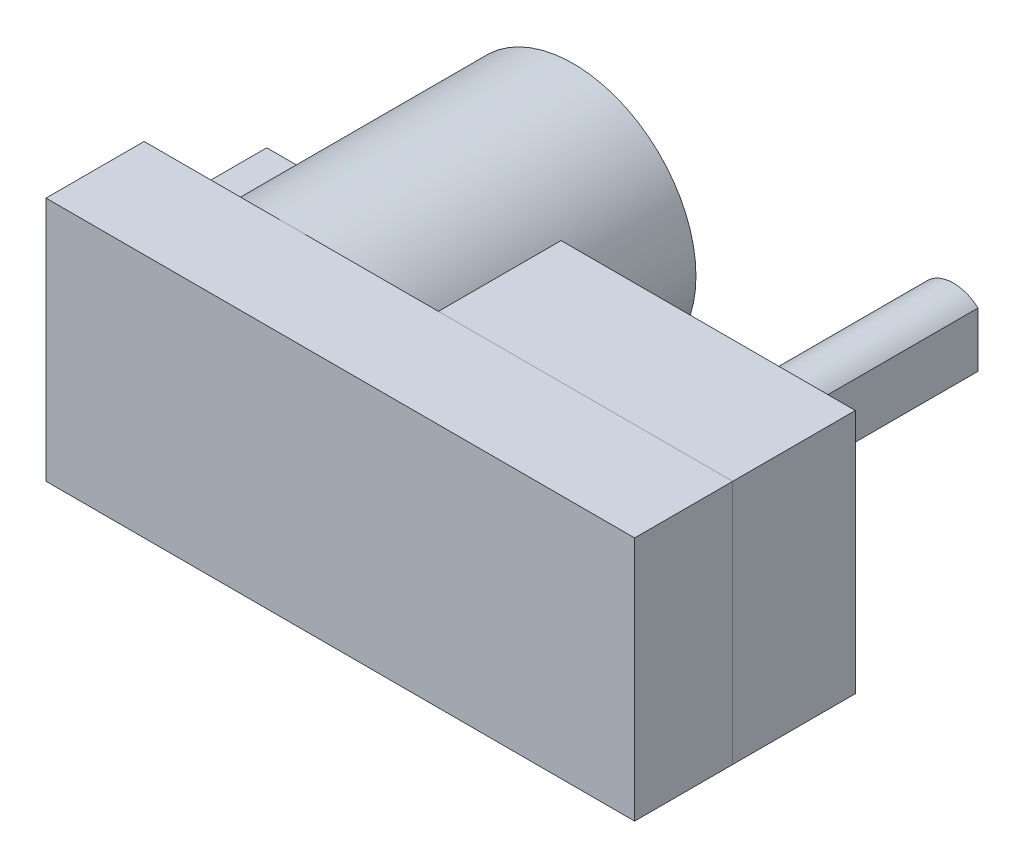
from build123d import *

# Parameters (mm, degrees)
SKETCH_1_W                   = 24
SKETCH_1_H                   = 10
EXTRUDE_1_DEPTH              = 4
SKETCH_2_R                   = 5
EXTRUDE_2_DEPTH              = 11.5
SKETCH_4_R                   = 1.223700811
EXTRUDE_3_DEPTH              = 1
SKETCH_5_W                   = 12
SKETCH_5_H                   = 10
EXTRUDE_4_DEPTH              = 5
SKETCH_6_R                   = 1.5
EXTRUDE_5_DEPTH              = 10
HOLE_START                   = -9
HOLE_WIZARD_M1_6_1_OUTLINE_R = 0.625
HOLE_WIZARD_M1_6_1_DEPTH     = 5.001
SKETCH_9_W                   = 1.535552224
SKETCH_9_H                   = 5.125451512
EXTRUDE_6_DEPTH              = 5
CUT_EXTRUDE1_DEPTH           = 33.202484376
CUT_EXTRUDE1_DEPTH_BACK      = 9


# Read off the part's stored shape, not the designer's step: M1.6 螺纹孔1
with BuildPart() as part:
    # 草图1 → 凸台-拉伸1 (new body)
    with BuildSketch(Plane.XY):
        with Locations((12, 5)):
            Rectangle(SKETCH_1_W, SKETCH_1_H)
    extrude(amount=-EXTRUDE_1_DEPTH)


with BuildPart() as body_2:
    # 草图2 → 凸台-拉伸2 (new body)
    with BuildSketch(Plane(origin=(0, 0, -4), x_dir=(-1, 0, 0), z_dir=(0, 0, -1))):
        with Locations((-6, 5)):
            Circle(SKETCH_2_R)
    extrude(amount=EXTRUDE_2_DEPTH)

    # 草图4 → 凸台-拉伸3 (add)
    with BuildSketch(Plane(origin=(0, 0, -15.5), x_dir=(-1, 0, 0), z_dir=(0, 0, -1))):
        with Locations((-6.056056762, 4.515848892)):
            Circle(SKETCH_4_R)
    extrude(amount=EXTRUDE_3_DEPTH)


with BuildPart() as body_3:
    # 草图5 → 凸台-拉伸4 (new body)
    with BuildSketch(Plane(origin=(0, 0, -4), x_dir=(-1, 0, 0), z_dir=(0, 0, -1))):
        with Locations((-18, 5)):
            Rectangle(SKETCH_5_W, SKETCH_5_H)
    extrude(amount=EXTRUDE_4_DEPTH)


with BuildPart() as body_4:
    # 草图6 → 凸台-拉伸5 (new body)
    with BuildSketch(Plane(origin=(0, 0, -9), x_dir=(-1, 0, 0), z_dir=(0, 0, -1))):
        with Locations((-18, 5)):
            Circle(SKETCH_6_R)
    extrude(amount=EXTRUDE_5_DEPTH)

    # Sketch1 → Cut-Extrude1 (cut, two sides: drawn at the far end of the back side and taken through both)
    with BuildSketch(Plane(origin=(0, 0, -19), x_dir=(-1, 0, 0), z_dir=(0, 0, -1)).offset(-CUT_EXTRUDE1_DEPTH_BACK)):
        Polygon((-19, -46.039473837), (-19, 3.881966011), (-19, 6.118033989), (-19, 56.039473837), (-118.842879696, 56.039473837), (-118.842879696, -46.039473837), align=None)
    extrude(amount=CUT_EXTRUDE1_DEPTH + CUT_EXTRUDE1_DEPTH_BACK, mode=Mode.SUBTRACT)


with BuildPart() as hole_wizard_m1_6_1_tool:
    # M1.6 螺纹孔1 outline → M1.6 螺纹孔1 (new body)
    with BuildSketch(Plane.XY.offset(HOLE_START)):
        with Locations((13.5, 5)):
            Circle(HOLE_WIZARD_M1_6_1_OUTLINE_R)
        with Locations((22.5, 5)):
            Circle(HOLE_WIZARD_M1_6_1_OUTLINE_R)
    extrude(amount=HOLE_WIZARD_M1_6_1_DEPTH)


with BuildPart() as part_1:
    add(part.part)

    # M1.6 螺纹孔1: cut by hole_wizard_m1_6_1_tool
    add(hole_wizard_m1_6_1_tool.part, mode=Mode.SUBTRACT)


with BuildPart() as body_3_1:
    add(body_3.part)

    # M1.6 螺纹孔1: cut by hole_wizard_m1_6_1_tool
    add(hole_wizard_m1_6_1_tool.part, mode=Mode.SUBTRACT)


with BuildPart() as body_5:
    # 草图9 → 凸台-拉伸6 (new body)
    with BuildSketch(Plane(origin=(0, 0, -4), x_dir=(-1, 0, 0), z_dir=(0, 0, -1))):
        with Locations((-0.767776112, 4.713713687)):
            Rectangle(SKETCH_9_W, SKETCH_9_H)
    extrude(amount=EXTRUDE_6_DEPTH)


solid = Compound([body_2.part, body_4.part, part_1.part, body_3_1.part, body_5.part])
